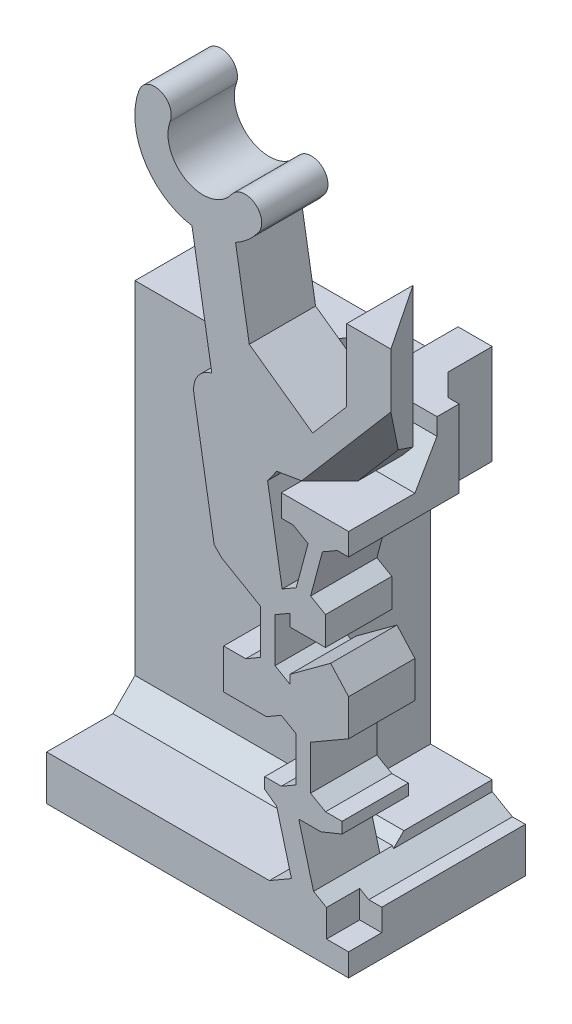
from build123d import *

# Parameters (mm, degrees)
BOSS_SWITCH_BODY_DEPTH                         = 3
SKETCH1_W                                      = 4
SKETCH1_H                                      = 3.5
BOSS_FLANGE_WIDTH_DEPTH                        = 5
BOSS_FLANGE_HEIGHT_REACH                       = 38.166
SKETCH2_W                                      = 4
SKETCH2_H                                      = 2
SKETCH2_W_2                                    = 8
SKETCH2_H_2                                    = 2.024978658
CUT_UP_TO_DOWN_DERAILLEUR_CLEARANCE_REACH      = 23.862
SKETCH10_W                                     = 2.453096586
SKETCH10_H                                     = 3
SKETCH17_W                                     = 12.1675
SKETCH17_H                                     = 4
BOSS_FLANGE_SUPPORT_DEPTH                      = 14.475021342
TAP_DRILL_FOR_M2X0_4_TAP1_D                    = 1.6
M2_CLEARANCE_HOLE2_D                           = 2.4
M2_CLEARANCE_HOLE2_DEPTH                       = 15
M2_CLEARANCE_HOLE2_TIP                         = 0.721032743
CUT_UP_TO_DOWN_CANTILEVER_SLOPE_REACH          = 31.347
CUT_DOWN_TO_UP_DERAILLEUR_CLEARANCE_DEPTH      = 33.698678667
CUT_DOWN_TO_UP_DERAILLEUR_CLEARANCE_DEPTH_BACK = 33.698678667
CHAMFER_FLANGE_SUPPORT_SIZE                    = 1.5
CHAMFER_FLANGE_SUPPORT_2_SIZE                  = 1
CHAMFER_FLANGE_SUPPORT_3_SIZE                  = 1
SKETCH18_W                                     = 1.5
SKETCH18_H                                     = 1.577331094
CUT_DOWN_TO_UP_DERAILLEUR_CLEARANCE_2_DEPTH    = 1
SKETCH19_W                                     = 3.046903414
SKETCH19_H                                     = 2.563581512
CUT_UP_TO_DOWN_CANTILEVER_CLEARANCE_DEPTH      = 1
CHAMFER1_SIZE                                  = 1
CHAMFER1_SIZE_2                                = 1.732050808
CHAMFER3_SIZE                                  = 0.75
CHAMFER3_SIZE_2                                = 1.299038106
CHAMFER4_SIZE                                  = 0.5
CHAMFER4_SIZE2                                 = 0.866025404
CHAMFER5_SIZE                                  = 0.5
CHAMFER6_SIZE                                  = 2.5
CHAMFER7_SIZE                                  = 1
CUT_EXTRUDE3_REACH                             = 33.008
SKETCH23_W                                     = 2.791062273
SKETCH23_H                                     = 12.475021342
CUT_GAP_FOR_PRINTING_DEPTH                     = 31.862053717


# Some blends are built 0.0001 mm under size
with BuildPart() as part:
    # Sketch-SwitchBossUp → Boss-Switch Body (new body)
    with BuildSketch(Plane.XY):
        with BuildLine():
            Line((6.540476927, 21.177422148), (6.540476927, 24.438379064))
            Line((6.540476927, 24.438379064), (8.540476927, 24.438379064))
            Line((8.540476927, 24.438379064), (8.540476927, 20.438379064))
            Line((8.540476927, 20.438379064), (6.040476927, 17.517528279))
            Line((6.040476927, 17.517528279), (2.878366495, 16.985217616))
            Line((2.878366495, 16.985217616), (3.620297651, 12.577888564))
            Line((3.620297651, 12.577888564), (4.256080915, 12.944958203))
            Line((4.256080915, 12.944958203), (4.791964496, 14.944962169))
            Line((4.791964496, 14.944962169), (4.116925685, 15.334689347))
            Line((4.116925685, 15.334689347), (3.581073513, 15.334689347))
            Line((3.581073513, 15.334689347), (3.581073513, 16.334689347))
            Line((3.581073513, 16.334689347), (6.857327822, 16.334689347))
            Line((6.857327822, 16.334689347), (13.441613484, 16.334689347))
            Line((13.441613484, 16.334689347), (13.441613484, -1.165310653))
            Line((13.441613484, -1.165310653), (5.040476927, -1.165310653))
            Line((5.040476927, -1.165310653), (3.040476927, -1.165310653))
            Line((3.040476927, -1.165310653), (3.040476927, 0.859668005))
            Line((3.040476927, 0.859668005), (4.040476927, 1.437018274))
            Line((4.040476927, 1.437018274), (3.370603946, 3.937018274))
            Line((3.370603946, 3.937018274), (2.83114552, 4.326720436))
            Line((2.83114552, 4.326720436), (2.83114552, 4.826720436))
            Line((2.83114552, 4.826720436), (3.58114552, 4.826720436))
            Line((3.58114552, 4.826720436), (4.256138119, 5.216427595))
            Line((4.256138119, 5.216427595), (4.256138119, 7.216427595))
            Line((4.256138119, 7.216427595), (3.581130717, 7.6061433))
            Line((3.581130717, 7.6061433), (2.9061262, 7.216422599))
            Line((2.9061262, 7.216422599), (0.971281627, 7.216422599))
            Line((0.971281627, 7.216422599), (0.971281627, 9.019692757))
            Line((0.971281627, 9.019692757), (1.971281627, 9.019692757))
            Line((1.971281627, 9.019692757), (2.646271341, 9.40939825))
            Line((2.646271341, 9.40939825), (2.646271341, 11.40939825))
            Line((2.646271341, 11.40939825), (0.897326855, 12.41915182))
            Line((0.897326855, 12.41915182), (0.545466745, 12.771663724))
            Line((0.545466745, 12.771663724), (-0.372784255, 18.226393961))
            ThreePointArc((-0.372784255, 18.226393961), (-0.209313172, 18.996084896), (0.435897335, 19.446473985))
            Line((0.435897335, 19.446473985), (-0.46073685, 24.772792819))
            ThreePointArc((-0.46073685, 24.772792819), (-2.630501593, 26.270619745), (-2.852546321, 28.897797067))
            ThreePointArc((-2.852546321, 28.897797067), (-1.887813913, 29.338582026), (-1.447028953, 28.373849618))
            ThreePointArc((-1.447028953, 28.373849618), (-0.703448682, 26.416936722), (1.333779254, 26.898727173))
            ThreePointArc((1.333779254, 26.898727173), (2.379722745, 27.074801628), (2.555797201, 26.028858137))
            ThreePointArc((2.555797201, 26.028858137), (2.086504637, 25.507104397), (1.511513111, 25.104801997))
            Line((1.511513111, 25.104801997), (2.546357317, 18.957467576))
            Line((2.546357317, 18.957467576), (4.992893704, 19.36931828))
            Line((4.992893704, 19.36931828), (6.540476927, 21.177422148))
        make_face()
        Polygon((5.581091201, 12.555245643), (5.581100766, 11.263016278), (3.971265023, 11.263016278), (3.97126394, 11.79911022), (3.296271341, 11.409403061), (3.296271341, 9.409403061), (3.971278743, 9.019687356), (3.971278743, 9.409408058), (5.815189335, 10.763016278), (6.627976927, 9.860324206), (6.627976927, 8.210536506), (5.581127833, 7.606137899), (4.906138119, 7.216432406), (4.906138119, 5.216432406), (5.58114552, 4.826716701), (6.33114552, 4.826716701), (6.33114552, 4.326716701), (5.370603946, 3.937018274), (4.370603946, 3.937018274), (5.040476927, 1.437018274), (6.040487998, 0.85968718), (9.127976927, 0.85968718), (10.437466736, 2.169176988), (10.437466736, 14.025199539), (9.127976927, 15.334689347), (6.116971898, 15.334689347), (5.441964496, 14.94496698), (4.906080915, 12.944963014), align=None, mode=Mode.SUBTRACT)
    extrude(amount=BOSS_SWITCH_BODY_DEPTH)

    # Sketch1 → Boss-Flange Width (add)
    with BuildSketch(Plane(origin=(0, 0, 0), x_dir=(-1, 0, 0), z_dir=(0, 0, -1))):
        Polygon((-7.581073513, -1.165310653), (0.412170615, -1.165310653), (0.412170615, 0.859668005), (-3.040476927, 0.859668005), (-4.040476927, 1.437018274), (-5.040476927, 1.437018274), (-6.040487998, 0.85968718), (-7.581073513, 0.85968718), align=None)
        with Locations((-5.581073513, 17.084689347)):
            Rectangle(SKETCH1_W, SKETCH1_H)
    extrude(amount=BOSS_FLANGE_WIDTH_DEPTH)

    # Sketch2 → Boss-Flange Height (add, up to next)
    with BuildSketch(Plane(origin=(-7.039523073, 0, 0), x_dir=(0, 0, -1), z_dir=(1, 0, 0)), mode=Mode.PRIVATE) as boss_flange_height_sk1:
        with Locations((3, 16.334689347)):
            Rectangle(SKETCH2_W, SKETCH2_H)
    boss_flange_height_tool1 = extrude(boss_flange_height_sk1.sketch, amount=BOSS_FLANGE_HEIGHT_REACH, mode=Mode.PRIVATE) - part.part
    # Sketch2 → Boss-Flange Height (add, up to next)
    with BuildSketch(Plane(origin=(-7.039523073, 0, 0), x_dir=(0, 0, -1), z_dir=(1, 0, 0)), mode=Mode.PRIVATE) as boss_flange_height_sk2:
        with Locations((1, -0.152821324)):
            Rectangle(SKETCH2_W_2, SKETCH2_H_2)
    boss_flange_height_tool2 = extrude(boss_flange_height_sk2.sketch, amount=BOSS_FLANGE_HEIGHT_REACH, mode=Mode.PRIVATE) - part.part
    add(boss_flange_height_tool1.solids().sort_by_distance((-7.039523, 16.334689, -3))[0])
    add(boss_flange_height_tool2.solids().sort_by_distance((-7.039523, -0.152821, -1))[0])

    # Sketch10 → Cut-Up-To-Down Derailleur Clearance (cut, up to next)
    with BuildSketch(Plane(origin=(0, 15.334689347, 0), x_dir=(1, 0, 0), z_dir=(0, 1, 0)), mode=Mode.PRIVATE) as cut_up_to_down_derailleur_clearance_sk1:
        with Locations((6.35452522, 3.5)):
            Rectangle(SKETCH10_W, SKETCH10_H)
    cut_up_to_down_derailleur_clearance_tool1 = extrude(cut_up_to_down_derailleur_clearance_sk1.sketch, amount=CUT_UP_TO_DOWN_DERAILLEUR_CLEARANCE_REACH, mode=Mode.PRIVATE) & part.part
    add(cut_up_to_down_derailleur_clearance_tool1.solids().sort_by_distance((6.354525, 15.334689, -3.5))[0], mode=Mode.SUBTRACT)

    # Sketch17 → Boss-Flange Support (add)
    with BuildSketch(Plane.XZ.offset(-15.334689347)):
        with Locations((-0.955773073, -3)):
            Rectangle(SKETCH17_W, SKETCH17_H)
    extrude(amount=BOSS_FLANGE_SUPPORT_DEPTH)

    # Tap Drill for M2x0.4 Tap1 (through all)
    with Locations(Plane(origin=(0, -1.165310653, 0), x_dir=(-1, 0, 0), z_dir=(0, -1, 0))):
        with Locations((4.039523073, 3), (-0.581073513, 3)):
            Hole(TAP_DRILL_FOR_M2X0_4_TAP1_D / 2)

    # M2 Clearance Hole2
    with Locations(Plane.XZ.offset(1.165310653)):
        with Locations((-4.039523073, -3), (0.581073513, -3)):
            Hole(M2_CLEARANCE_HOLE2_D / 2, depth=M2_CLEARANCE_HOLE2_DEPTH)
            with Locations((0, 0, -(M2_CLEARANCE_HOLE2_DEPTH + M2_CLEARANCE_HOLE2_TIP / 2))):  # 118° drill point
                Cone(0, M2_CLEARANCE_HOLE2_D / 2, M2_CLEARANCE_HOLE2_TIP, mode=Mode.SUBTRACT)

    # Sketch12 → Cut-Up-to-Down Cantilever Slope (cut, up to next)
    with BuildSketch(Plane(origin=(0, 24.438379064, 0), x_dir=(1, 0, 0), z_dir=(0, 1, 0)), mode=Mode.PRIVATE) as cut_up_to_down_cantilever_slope_sk1:
        Polygon((6.540476927, 0), (8.540476927, -3), (8.540476927, 0), align=None)
    cut_up_to_down_cantilever_slope_tool1 = extrude(cut_up_to_down_cantilever_slope_sk1.sketch, amount=-CUT_UP_TO_DOWN_CANTILEVER_SLOPE_REACH, mode=Mode.PRIVATE) & part.part
    add(cut_up_to_down_cantilever_slope_tool1.solids().sort_by_distance((7.87381, 24.438379, 1))[0], mode=Mode.SUBTRACT)

    # Sketch16 → Cut-Down-to-Up Derailleur Clearance (cut, two sides: drawn at the far end of the back side and taken through both)
    with BuildSketch(Plane(origin=(0, 0, 0), x_dir=(-1, 0, 0), z_dir=(0, 0, -1)).offset(-CUT_DOWN_TO_UP_DERAILLEUR_CLEARANCE_DEPTH_BACK)):
        Polygon((-7.581073513, 18.834689347), (-13.441613484, 18.834689347), (-13.441613484, -1.165310653), (-6.627976927, -1.165310653), (-6.627976927, 5.203794929), (-8.003689255, 5.203794929), (-8.003689255, 12.048417413), (-6.627976927, 12.048417413), (-6.627976927, 17.947659965), align=None)
    extrude(amount=CUT_DOWN_TO_UP_DERAILLEUR_CLEARANCE_DEPTH + CUT_DOWN_TO_UP_DERAILLEUR_CLEARANCE_DEPTH_BACK, mode=Mode.SUBTRACT)

    # Chamfer-Flange Support
    chamfer_flange_support_edges = [part.edges().sort_by_distance(p)[0] for p in [
        (3.581073513, 17.334689347, -3),
    ]]
    chamfer(chamfer_flange_support_edges, length=CHAMFER_FLANGE_SUPPORT_SIZE - 0.0001)  # a hair under: the kernel refuses the full size

    # Chamfer-Flange Support 2
    chamfer_flange_support_2_edges = [part.edges().sort_by_distance(p)[0] for p in [
        (5.127976927, 17.084689347, -2),
        (5.127976927, 15.334689347, -1.5),
    ]]
    chamfer(chamfer_flange_support_2_edges, length=CHAMFER_FLANGE_SUPPORT_2_SIZE)

    # Chamfer-Flange Support 3
    chamfer_flange_support_3_edges = [part.edges().sort_by_distance(p)[0] for p in [
        (-1.999523073, 0.859668005, -1),
    ]]
    chamfer(chamfer_flange_support_3_edges, length=CHAMFER_FLANGE_SUPPORT_3_SIZE)

    # Sketch18 → Cut-Down-to-Up Derailleur Clearance 2 (cut)
    with BuildSketch(Plane(origin=(6.627976927, 0, 0), x_dir=(0, 0, -1), z_dir=(1, 0, 0))):
        with Locations((-2.25, 0.648352727)):
            Rectangle(SKETCH18_W, SKETCH18_H)
    extrude(amount=-CUT_DOWN_TO_UP_DERAILLEUR_CLEARANCE_2_DEPTH, mode=Mode.SUBTRACT)

    # Sketch19 → Cut-Up-to-Down Cantilever Clearance (cut)
    with BuildSketch(Plane.XY):
        with Locations((5.10452522, 17.616480103)):
            Rectangle(SKETCH19_W, SKETCH19_H)
    extrude(amount=-CUT_UP_TO_DOWN_CANTILEVER_CLEARANCE_DEPTH, mode=Mode.SUBTRACT)

    # Chamfer1
    # the kernel refuses this chamfer: 1.732050808, 1 mm, written as the material it adds along each edge
    with BuildSketch(Plane(origin=(6.627976927, 16.334689347, -1), x_dir=(0, -0.05789386240266977, 0.9983227437537926), z_dir=(-1, 0, 0))) as chamfer1_piece_1:
        Polygon((CHAMFER1_SIZE * 0.998322743754, CHAMFER1_SIZE * 0.0578938624027), (-CHAMFER1_SIZE_2 * 0.0578938623883, CHAMFER1_SIZE_2 * 0.998322743505), (0, 0), align=None)
    extrude(amount=3.046903414)

    # Chamfer3
    # the kernel refuses this chamfer: 1.299038106, 0.75 mm, written as the material it adds along each edge
    with BuildSketch(Plane(origin=(3.581073513, 15.334689347, -1), x_dir=(0.05789386240236086, -1.5934376059306423e-13, 0.9983227437538106), z_dir=(0, 1, 0))) as chamfer3_piece_1_section:
        Polygon((CHAMFER3_SIZE * 0.998322743754, -CHAMFER3_SIZE * 0.0578938624027), (-CHAMFER3_SIZE_2 * 0.057893862388, -CHAMFER3_SIZE_2 * 0.998322743505), (0, 0), align=None)
    chamfer3_piece_1 = extrude(amount=6.092773786, mode=Mode.PRIVATE)
    chamfer3_piece_1 = split(chamfer3_piece_1, bisect_by=Plane(origin=(3.127107762, 16.799062109, -0.268105739), z_dir=(0, -0.4999999999999566, -0.8660254037844637)), keep=Keep.TOP, mode=Mode.PRIVATE)
    chamfer3_piece_1 = split(chamfer3_piece_1, bisect_by=Plane(origin=(2.18713947, 17.440655304, -0.784906566), z_dir=(0.7071067811865476, -0.7071067811865476, 0)), keep=Keep.TOP, mode=Mode.PRIVATE)
    add(chamfer3_piece_1)

    # Chamfer4
    chamfer4_edges = [part.edges().sort_by_distance(p)[0] for p in [
        (4.205006167, 15.334689347, -1),
    ]]
    chamfer4_side = [part.faces().sort_by_distance(p)[0] for p in [
        (2.964678171, 15.334689347, -0.682371949),
    ]]
    chamfer(chamfer4_edges, length=CHAMFER4_SIZE, length2=CHAMFER4_SIZE2, reference=chamfer4_side[0])

    # Chamfer5
    chamfer5_edges = [part.edges().sort_by_distance(p)[0] for p in [
        (2.878366495, 16.985217616, 1.5),
    ]]
    chamfer(chamfer5_edges, length=CHAMFER5_SIZE)

    # Chamfer6
    # the kernel refuses this chamfer: 2.5 mm, written as the material it adds along each edge
    with BuildSketch(Plane(origin=(2.546357317, 18.957467576, 0), x_dir=(0.9903165846799726, 0.13882745444541758, 0), z_dir=(0, 0, 1))) as chamfer6_piece_1:
        Polygon((CHAMFER6_SIZE * 0.999621916911, CHAMFER6_SIZE * 0.0274958766106), (-CHAMFER6_SIZE * 0.0274958766106, CHAMFER6_SIZE * 0.999621916911), (0, 0), align=None)
    extrude(amount=3)

    # Chamfer7
    chamfer7_edges = [part.edges().sort_by_distance(p)[0] for p in [
        (7.290476927, 18.977953671, 3),
    ]]
    chamfer(chamfer7_edges, length=CHAMFER7_SIZE)

    # Sketch22 → Cut-Extrude3 (cut, up to next)
    with BuildSketch(Plane.XY, mode=Mode.PRIVATE) as cut_extrude3_sk1:
        Polygon((6.627976927, 17.947659965), (7.581073513, 18.834689347), (6.627976927, 18.834689347), align=None)
    cut_extrude3_tool1 = extrude(cut_extrude3_sk1.sketch, amount=-CUT_EXTRUDE3_REACH, mode=Mode.PRIVATE) & part.part
    add(cut_extrude3_tool1.solids().sort_by_distance((6.945676, 18.539013, 0))[0], mode=Mode.SUBTRACT)

    # Sketch23 → Cut-Gap for Printing (cut, through all)
    with BuildSketch(Plane.XY.offset(-1)):
        with Locations((3.732445791, 8.097178676)):
            Rectangle(SKETCH23_W, SKETCH23_H)
    extrude(amount=-CUT_GAP_FOR_PRINTING_DEPTH, mode=Mode.SUBTRACT)


solid = part.part
